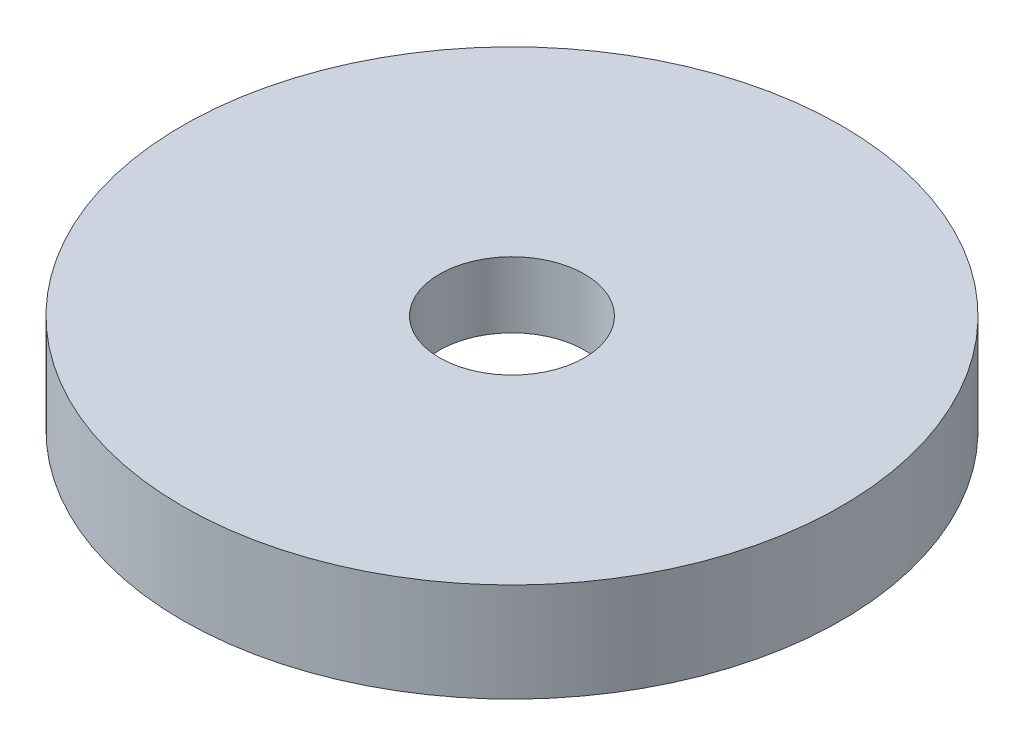
from build123d import *

# Parameters (mm, degrees)
SKETCH1_R           = 5
SKETCH1_R_2         = 1.1
BOSS_EXTRUDE1_DEPTH = 1.5
SKETCH1_3_R         = 2.5
SKETCH1_3_R_2       = 1.1
CUT_EXTRUDE1_DEPTH  = 0.5


with BuildPart() as part:
    # Sketch1 → Boss-Extrude1 (new body)
    with BuildSketch(Plane(origin=(0, 0, 0), x_dir=(1, 0, 0), z_dir=(0, 1, 0))):
        Circle(SKETCH1_R)
        Circle(SKETCH1_R_2, mode=Mode.SUBTRACT)
    extrude(amount=BOSS_EXTRUDE1_DEPTH)

    # Sketch1<3> → Cut-Extrude1 (cut)
    with BuildSketch(Plane(origin=(0, 0, 0), x_dir=(1, 0, 0), z_dir=(0, 1, 0))):
        Circle(SKETCH1_3_R)
        Circle(SKETCH1_3_R_2, mode=Mode.SUBTRACT)
    extrude(amount=CUT_EXTRUDE1_DEPTH, mode=Mode.SUBTRACT)


solid = part.part
